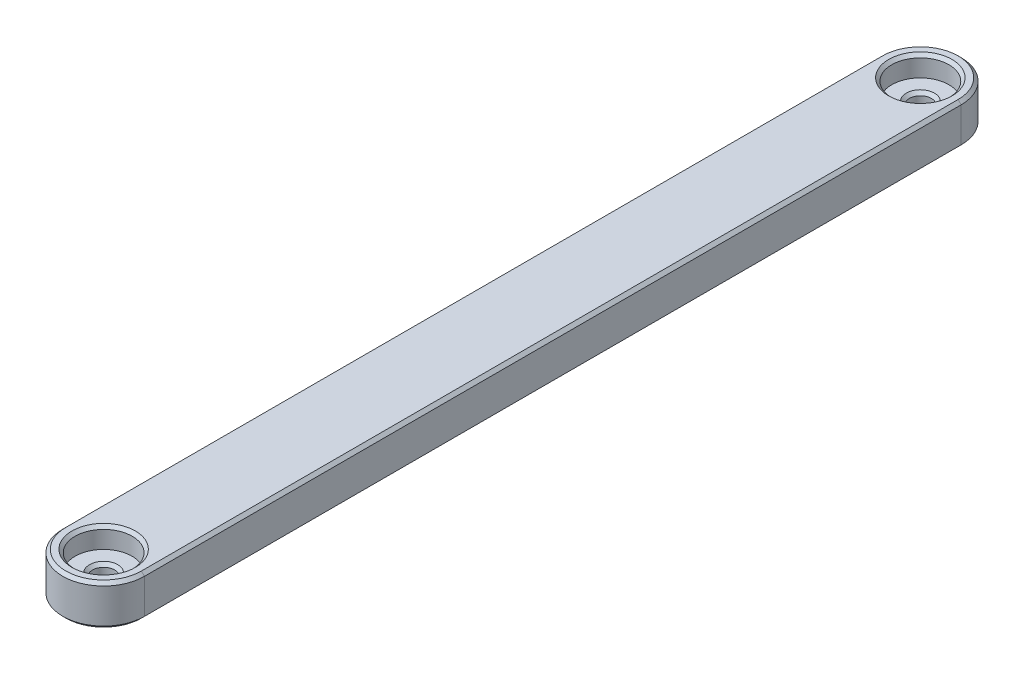
from build123d import *

# Parameters (mm, degrees)
SKETCH1_R           = 2.7
BOSS_EXTRUDE1_DEPTH = 10
SKETCH3_R           = 7
CUT_EXTRUDE3_DEPTH  = 5
CHAMFER1_SIZE       = 0.75


with BuildPart() as part:
    # Sketch1 → Boss-Extrude1 (new body)
    with BuildSketch(Plane(origin=(0, 0, 0), x_dir=(1, 0, 0), z_dir=(0, 1, 0))):
        with BuildLine():
            ThreePointArc((-10, -100), (0, -110), (10, -100))
            Line((10, -100), (10, 100))
            ThreePointArc((10, 100), (0, 110), (-10, 100))
            Line((-10, 100), (-10, -100))
        make_face()
        with Locations((0, -100)):
            Circle(SKETCH1_R, mode=Mode.SUBTRACT)
        with Locations((0, 100)):
            Circle(SKETCH1_R, mode=Mode.SUBTRACT)
    extrude(amount=BOSS_EXTRUDE1_DEPTH)

    # Sketch3 → Cut-Extrude3 (cut)
    with BuildSketch(Plane(origin=(0, 10, 0), x_dir=(1, 0, 0), z_dir=(0, 1, 0))):
        with Locations((0, 100)):
            Circle(SKETCH3_R)
        with Locations((0, -100)):
            Circle(SKETCH3_R)
    extrude(amount=-CUT_EXTRUDE3_DEPTH, mode=Mode.SUBTRACT)

    # Chamfer1
    chamfer1_edges = [part.edges().sort_by_distance(p)[0] for p in [
        (-2.7, 0, 100),
        (-2.7, 0, -100),
        (10, 10, 0),
        (0, 10, 110),
        (0, 10, -110),
        (-10, 10, 0),
        (10, 0, 0),
        (0, 0, 110),
        (0, 0, -110),
        (-10, 0, 0),
        (-2.7, 5, 100),
        (-2.7, 5, -100),
        (-7, 10, -100),
        (-7, 10, 100),
    ]]
    chamfer(chamfer1_edges, length=CHAMFER1_SIZE)


solid = part.part
